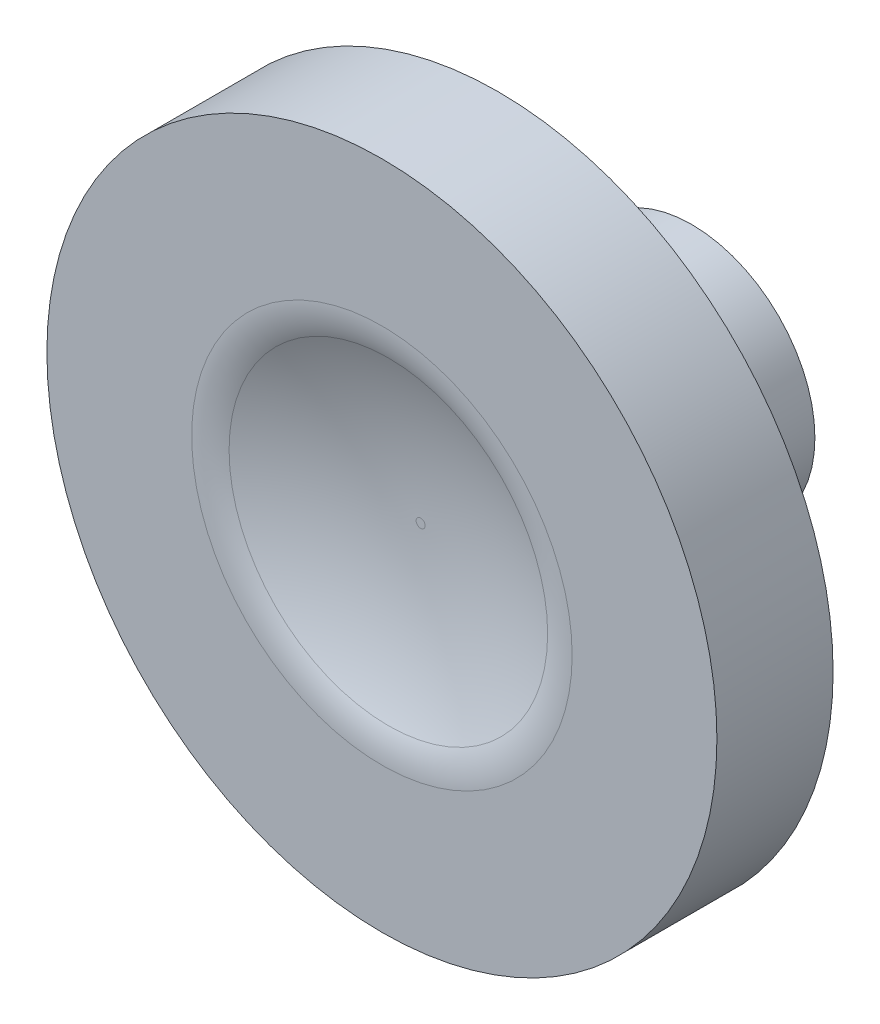
from build123d import *

# Parameters (mm, degrees)
SKETCH1_R           = 4.0386
BOSS_EXTRUDE1_DEPTH = 2.54
SKETCH1_4_R         = 10.9855
SKETCH1_4_R_2       = 4.0386
BOSS_EXTRUDE2_DEPTH = 3.81
FILLET1_R           = 2.54
FILLET2_R           = 12.7
SKETCH1_6_R         = 4.0386
BOSS_EXTRUDE3_DEPTH = 6.35
SKETCH3_R           = 2.54
CUT_EXTRUDE1_DEPTH  = 3.81


with BuildPart() as part:
    # Sketch1 → Boss-Extrude1 (new body)
    with BuildSketch(Plane.XY):
        Circle(SKETCH1_R)
    extrude(amount=BOSS_EXTRUDE1_DEPTH)

    # Sketch1<4> → Boss-Extrude2 (add)
    with BuildSketch(Plane.XY):
        with Locations(Location((0, 0, 0), (0, 0, 180))):
            Circle(SKETCH1_4_R)
        with Locations(Location((0, 0, 0), (0, 0, 180))):
            Circle(SKETCH1_4_R_2, mode=Mode.SUBTRACT)
    extrude(amount=BOSS_EXTRUDE2_DEPTH)

    # Fillet1
    # the kernel refuses this fillet: 2.54 mm, written as the material it takes off along each edge
    with BuildSketch(Plane(origin=(0, 0, 3.81), x_dir=(-1, 0, 0), z_dir=(0, 1, 0))) as fillet1_piece_1:
        with BuildLine():
            CenterArc((6.238304526, -2.54), FILLET1_R, 90, 60)
            Line((4.0386, -1.27), (3.994605909, -1.2446))
            ThreePointArc((3.994605909, -1.2446), (3.9878, -0.635), (3.9878, 0))
            Line((3.9878, 0), (4.0386, 0.0508))
            Line((4.0386, 0.0508), (6.238304526, 0.0508))
            Line((6.238304526, 0.0508), (6.238304526, 0))
        make_face()
    revolve(axis=Axis((0, 0, 3.81), (0, 0, 1)), mode=Mode.SUBTRACT)

    # Fillet2
    fillet2_edges = [part.edges().sort_by_distance(p)[0] for p in [
        (4.0386, 0, 2.54),
    ]]
    fillet(fillet2_edges, radius=FILLET2_R)

    # Sketch1<6> → Boss-Extrude3 (add)
    with BuildSketch(Plane.XY):
        Circle(SKETCH1_6_R)
    extrude(amount=-BOSS_EXTRUDE3_DEPTH)

    # Sketch3 → Cut-Extrude1 (cut)
    with BuildSketch(Plane(origin=(0, 0, -6.35), x_dir=(-1, 0, 0), z_dir=(0, 0, -1))):
        Circle(SKETCH3_R)
    extrude(amount=-CUT_EXTRUDE1_DEPTH, mode=Mode.SUBTRACT)


solid = part.part
